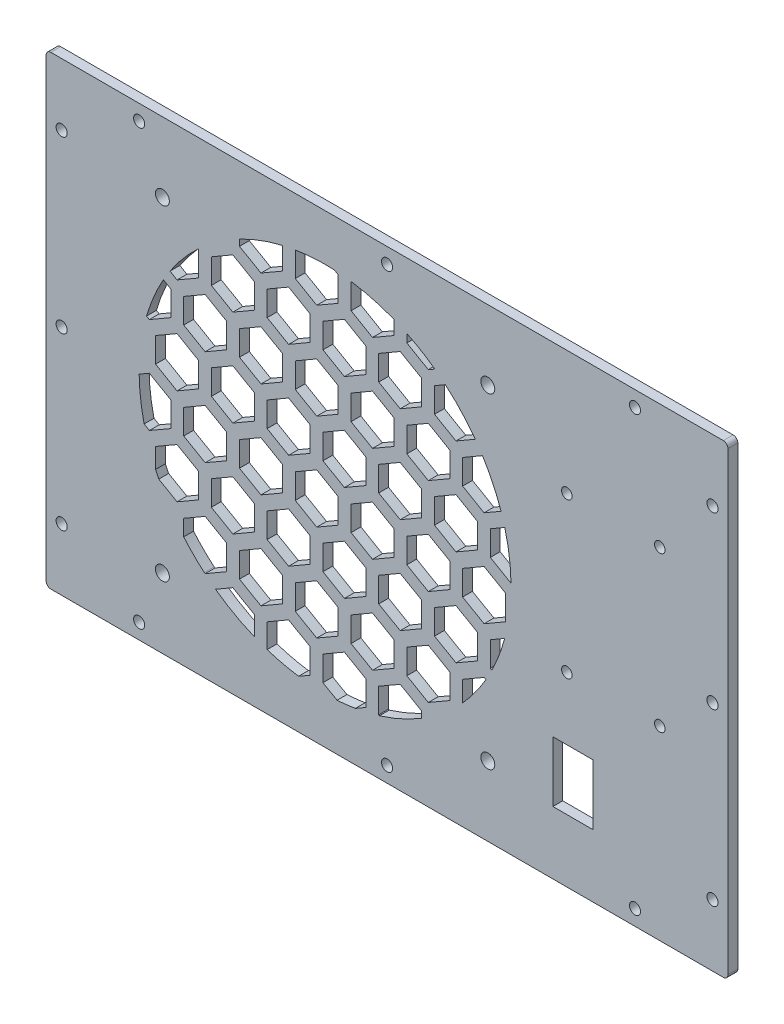
from build123d import *

# Parameters (mm, degrees)
SKETCH1_W            = 220
SKETCH1_H            = 150
BOSS_EXTRUDE1_DEPTH  = 3.175
M3_CLEARANCE_HOLE1_D = 3.6
SKETCH4_W            = 10
SKETCH4_H            = 10
BOSS_EXTRUDE2_DEPTH  = 3.175
FILLET2_R            = 1.5
M4_CLEARANCE_HOLE1_D = 4.5
SKETCH6_R            = 60
CUT_EXTRUDE1_DEPTH   = 10
BOSS_EXTRUDE3_START  = -3.175
BOSS_EXTRUDE3_DEPTH  = 3.175
SKETCH12_W           = 13
SKETCH12_H           = 19.5
CUT_EXTRUDE2_DEPTH   = 134.173122758
M3_CLEARANCE_HOLE2_D = 3.4


# Read off the part's stored shape, not the designer's step: Boss-Extrude3
with BuildPart() as part:
    # Sketch1 → Boss-Extrude1 (new body)
    with BuildSketch(Plane.XY):
        Rectangle(SKETCH1_W, SKETCH1_H)
    extrude(amount=BOSS_EXTRUDE1_DEPTH)

    # M3 Clearance Hole1 (through all)
    with Locations(Plane.XY.offset(3.175)):
        with Locations((0, 0), (-80, 70), (80, 70), (0, 70), (-105, 55), (-105, 0), (-105, -55), (-80, -70), (0, -70), (80, -70), (105, -55), (105, 0), (105, 55)):
            Hole(M3_CLEARANCE_HOLE1_D / 2)

    # Sketch4 → Boss-Extrude2 (add, through all)
    with BuildSketch(Plane.XY.offset(3.175)):
        Rectangle(SKETCH4_W, SKETCH4_H)
    extrude(amount=-BOSS_EXTRUDE2_DEPTH)

    # Fillet2
    fillet2_edges = [part.edges().sort_by_distance(p)[0] for p in [
        (-110, -75, 1.5875),
        (-110, 75, 1.5875),
        (110, 75, 1.5875),
        (110, -75, 1.5875),
    ]]
    fillet(fillet2_edges, radius=FILLET2_R)

    # M4 Clearance Hole1 (through all)
    with Locations(Plane.XY.offset(3.175)):
        with Locations((-72.5, 52.5), (32.5, 52.5), (32.5, -52.5), (-72.5, -52.5)):
            Hole(M4_CLEARANCE_HOLE1_D / 2)

    # Sketch6 → Cut-Extrude1 (cut)
    with BuildSketch(Plane.XY.offset(3.175)):
        with Locations((-20, 0)):
            Circle(SKETCH6_R)
    extrude(amount=-CUT_EXTRUDE1_DEPTH, mode=Mode.SUBTRACT)

    # Boss-Extrude3 outline → Boss-Extrude3 (add)
    with BuildSketch(Plane.XY.offset(3.175).offset(BOSS_EXTRUDE3_START)):
        with BuildLine():
            Line((-15.771267181, 59.221406587), (-15.771267181, 51.221406587))
            Line((-15.771267181, 51.221406587), (-22.699470411, 47.221406587))
            Line((-22.699470411, 47.221406587), (-29.627673641, 51.221406587))
            Line((-29.627673641, 51.221406587), (-29.627673641, 59.221406587))
            Line((-29.627673641, 59.221406587), (-29.624968598, 59.222968344))
            ThreePointArc((-29.624968598, 59.222968344), (-31.705383986, 58.847123853), (-33.771267181, 58.398220865))
            Line((-33.771267181, 58.398220865), (-33.771267181, 51.221406587))
            Line((-33.771267181, 51.221406587), (-40.699470411, 47.221406587))
            Line((-40.699470411, 47.221406587), (-47.627673641, 51.221406587))
            Line((-47.627673641, 51.221406587), (-47.627673641, 53.26078904))
            ThreePointArc((-47.627673641, 53.26078904), (-54.622578831, 49.002826807), (-60.972552501, 43.832065221))
            Line((-60.972552501, 43.832065221), (-60.843063951, 43.757304972))
            Line((-60.843063951, 43.757304972), (-60.843063951, 35.757304972))
            Line((-60.843063951, 35.757304972), (-67.771267181, 31.757304972))
            Line((-67.771267181, 31.757304972), (-70.058522519, 33.077852457))
            ThreePointArc((-70.058522519, 33.077852457), (-71.149938734, 31.363733316), (-72.182683216, 29.613638284))
            Line((-72.182683216, 29.613638284), (-69.771267181, 28.221406587))
            Line((-69.771267181, 28.221406587), (-69.771267181, 20.221406587))
            Line((-69.771267181, 20.221406587), (-76.699470411, 16.221406587))
            Line((-76.699470411, 16.221406587), (-77.614626087, 16.749771963))
            ThreePointArc((-77.614626087, 16.749771963), (-79.4477765, 8.121691275), (-79.996124777, -0.681917699))
            Line((-79.996124777, -0.681917699), (-76.699470411, 1.221406587))
            Line((-76.699470411, 1.221406587), (-69.771267181, -2.778593413))
            Line((-69.771267181, -2.778593413), (-69.771267181, -10.778593413))
            Line((-69.771267181, -10.778593413), (-76.699470411, -14.778593413))
            Line((-76.699470411, -14.778593413), (-78.390962681, -13.802009896))
            ThreePointArc((-78.390962681, -13.802009896), (-76.805098789, -19.317886829), (-74.699470411, -24.657005835))
            Line((-74.699470411, -24.657005835), (-74.699470411, -18.242695028))
            Line((-74.699470411, -18.242695028), (-67.771267181, -14.242695028))
            Line((-67.771267181, -14.242695028), (-60.843063951, -18.242695028))
            Line((-60.843063951, -18.242695028), (-60.843063951, -26.242695028))
            Line((-60.843063951, -26.242695028), (-67.771267181, -30.242695028))
            Line((-67.771267181, -30.242695028), (-73.660873716, -26.84232911))
            ThreePointArc((-73.660873716, -26.84232911), (-70.012814128, -33.146921772), (-65.627673641, -38.963000373))
            Line((-65.627673641, -38.963000373), (-65.627673641, -33.778593413))
            Line((-65.627673641, -33.778593413), (-58.699470411, -29.778593413))
            Line((-58.699470411, -29.778593413), (-51.771267181, -33.778593413))
            Line((-51.771267181, -33.778593413), (-51.771267181, -41.778593413))
            Line((-51.771267181, -41.778593413), (-58.699470411, -45.778593413))
            Line((-58.699470411, -45.778593413), (-58.967443695, -45.623878966))
            ThreePointArc((-58.967443695, -45.623878966), (-57.192526743, -47.082013067), (-55.363097064, -48.471139517))
            Line((-55.363097064, -48.471139517), (-49.771267181, -45.242695028))
            Line((-49.771267181, -45.242695028), (-42.843063951, -49.242695028))
            Line((-42.843063951, -49.242695028), (-42.843063951, -55.481478255))
            ThreePointArc((-42.843063951, -55.481478255), (-40.78535319, -56.284714557), (-38.699470411, -57.011663775))
            Line((-38.699470411, -57.011663775), (-38.699470411, -49.242695028))
            Line((-38.699470411, -49.242695028), (-31.771267181, -45.242695028))
            Line((-31.771267181, -45.242695028), (-24.843063951, -49.242695028))
            Line((-24.843063951, -49.242695028), (-24.843063951, -57.242695028))
            Line((-24.843063951, -57.242695028), (-28.556643636, -59.386731259))
            ThreePointArc((-28.556643636, -59.386731259), (-22.360545451, -59.953547228), (-16.139062936, -59.875647512))
            Line((-16.139062936, -59.875647512), (-20.699470411, -57.242695028))
            Line((-20.699470411, -57.242695028), (-20.699470411, -49.242695028))
            Line((-20.699470411, -49.242695028), (-13.771267181, -45.242695028))
            Line((-13.771267181, -45.242695028), (-6.843063951, -49.242695028))
            Line((-6.843063951, -49.242695028), (-6.843063951, -57.242695028))
            Line((-6.843063951, -57.242695028), (-10.232599569, -59.19964433))
            ThreePointArc((-10.232599569, -59.19964433), (-6.317118817, -58.418993166), (-2.462224364, -57.379669098))
            Line((-2.462224364, -57.379669098), (-2.699470411, -57.242695028))
            Line((-2.699470411, -57.242695028), (-2.699470411, -49.242695028))
            Line((-2.699470411, -49.242695028), (4.228732819, -45.242695028))
            Line((4.228732819, -45.242695028), (11.156936049, -49.242695028))
            Line((11.156936049, -49.242695028), (11.156936049, -51.27616733))
            ThreePointArc((11.156936049, -51.27616733), (18.15510117, -46.305380408), (24.372326359, -40.386837627))
            Line((24.372326359, -40.386837627), (24.372326359, -33.778593413))
            Line((24.372326359, -33.778593413), (31.300529589, -29.778593413))
            Line((31.300529589, -29.778593413), (31.892008488, -30.120083915))
            ThreePointArc((31.892008488, -30.120083915), (32.882355734, -28.345307408), (33.812026068, -26.538007658))
            Line((33.812026068, -26.538007658), (33.300529589, -26.242695028))
            Line((33.300529589, -26.242695028), (33.300529589, -18.242695028))
            Line((33.300529589, -18.242695028), (37.947305409, -15.559877758))
            ThreePointArc((37.947305409, -15.559877758), (39.541377076, -7.404351142), (39.993351207, 0.893202608))
            Line((39.993351207, 0.893202608), (33.300529589, 4.757304972))
            Line((33.300529589, 4.757304972), (33.300529589, 12.757304972))
            Line((33.300529589, 12.757304972), (37.975059683, 15.45614618))
            ThreePointArc((37.975059683, 15.45614618), (37.41210019, 17.431315261), (36.781869404, 19.386059604))
            Line((36.781869404, 19.386059604), (31.300529589, 16.221406587))
            Line((31.300529589, 16.221406587), (24.372326359, 20.221406587))
            Line((24.372326359, 20.221406587), (24.372326359, 28.221406587))
            Line((24.372326359, 28.221406587), (30.797690386, 31.931092237))
            ThreePointArc((30.797690386, 31.931092237), (29.664494055, 33.666571407), (28.472031126, 35.36187493))
            Line((28.472031126, 35.36187493), (22.228732819, 31.757304972))
            Line((22.228732819, 31.757304972), (15.300529589, 35.757304972))
            Line((15.300529589, 35.757304972), (15.300529589, 43.757304972))
            Line((15.300529589, 43.757304972), (18.792026609, 45.773121716))
            ThreePointArc((18.792026609, 45.773121716), (17.124010592, 47.136056661), (15.4081472, 48.438240182))
            Line((15.4081472, 48.438240182), (13.300529589, 47.221406587))
            Line((13.300529589, 47.221406587), (6.372326359, 51.221406587))
            Line((6.372326359, 51.221406587), (6.372326359, 53.89341706))
            ThreePointArc((6.372326359, 53.89341706), (4.317882596, 54.851076435), (2.228732819, 55.73045341))
            Line((2.228732819, 55.73045341), (2.228732819, 51.221406587))
            Line((2.228732819, 51.221406587), (-4.699470411, 47.221406587))
            Line((-4.699470411, 47.221406587), (-11.627673641, 51.221406587))
            Line((-11.627673641, 51.221406587), (-11.627673641, 59.221406587))
            Line((-11.627673641, 59.221406587), (-11.361780135, 59.374920274))
            ThreePointArc((-11.361780135, 59.374920274), (-14.168853948, 59.715975549), (-16.988879355, 59.924395303))
            Line((-16.988879355, 59.924395303), (-15.771267181, 59.221406587))
        make_face()
        Polygon((-33.771267181, -33.778593413), (-33.771267181, -41.778593413), (-40.699470411, -45.778593413), (-47.627673641, -41.778593413), (-47.627673641, -33.778593413), (-40.699470411, -29.778593413), align=None, mode=Mode.SUBTRACT)
        Polygon((-15.771267181, -33.778593413), (-15.771267181, -41.778593413), (-22.699470411, -45.778593413), (-29.627673641, -41.778593413), (-29.627673641, -33.778593413), (-22.699470411, -29.778593413), align=None, mode=Mode.SUBTRACT)
        Polygon((-51.771267181, -2.778593413), (-51.771267181, -10.778593413), (-58.699470411, -14.778593413), (-65.627673641, -10.778593413), (-65.627673641, -2.778593413), (-58.699470411, 1.221406587), align=None, mode=Mode.SUBTRACT)
        Polygon((-42.843063951, -18.242695028), (-42.843063951, -26.242695028), (-49.771267181, -30.242695028), (-56.699470411, -26.242695028), (-56.699470411, -18.242695028), (-49.771267181, -14.242695028), align=None, mode=Mode.SUBTRACT)
        Polygon((-24.843063951, -18.242695028), (-24.843063951, -26.242695028), (-31.771267181, -30.242695028), (-38.699470411, -26.242695028), (-38.699470411, -18.242695028), (-31.771267181, -14.242695028), align=None, mode=Mode.SUBTRACT)
        Polygon((-33.771267181, -2.778593413), (-33.771267181, -10.778593413), (-40.699470411, -14.778593413), (-47.627673641, -10.778593413), (-47.627673641, -2.778593413), (-40.699470411, 1.221406587), align=None, mode=Mode.SUBTRACT)
        Polygon((-15.771267181, -2.778593413), (-15.771267181, -10.778593413), (-22.699470411, -14.778593413), (-29.627673641, -10.778593413), (-29.627673641, -2.778593413), (-22.699470411, 1.221406587), align=None, mode=Mode.SUBTRACT)
        Polygon((2.228732819, -33.778593413), (2.228732819, -41.778593413), (-4.699470411, -45.778593413), (-11.627673641, -41.778593413), (-11.627673641, -33.778593413), (-4.699470411, -29.778593413), align=None, mode=Mode.SUBTRACT)
        Polygon((20.228732819, -33.778593413), (20.228732819, -41.778593413), (13.300529589, -45.778593413), (6.372326359, -41.778593413), (6.372326359, -33.778593413), (13.300529589, -29.778593413), align=None, mode=Mode.SUBTRACT)
        Polygon((-6.843063951, -18.242695028), (-6.843063951, -26.242695028), (-13.771267181, -30.242695028), (-20.699470411, -26.242695028), (-20.699470411, -18.242695028), (-13.771267181, -14.242695028), align=None, mode=Mode.SUBTRACT)
        Polygon((11.156936049, -18.242695028), (11.156936049, -26.242695028), (4.228732819, -30.242695028), (-2.699470411, -26.242695028), (-2.699470411, -18.242695028), (4.228732819, -14.242695028), align=None, mode=Mode.SUBTRACT)
        Polygon((2.228732819, -2.778593413), (2.228732819, -10.778593413), (-4.699470411, -14.778593413), (-11.627673641, -10.778593413), (-11.627673641, -2.778593413), (-4.699470411, 1.221406587), align=None, mode=Mode.SUBTRACT)
        Polygon((29.156936049, -18.242695028), (29.156936049, -26.242695028), (22.228732819, -30.242695028), (15.300529589, -26.242695028), (15.300529589, -18.242695028), (22.228732819, -14.242695028), align=None, mode=Mode.SUBTRACT)
        Polygon((20.228732819, -2.778593413), (20.228732819, -10.778593413), (13.300529589, -14.778593413), (6.372326359, -10.778593413), (6.372326359, -2.778593413), (13.300529589, 1.221406587), align=None, mode=Mode.SUBTRACT)
        Polygon((38.228732819, -2.778593413), (38.228732819, -10.778593413), (31.300529589, -14.778593413), (24.372326359, -10.778593413), (24.372326359, -2.778593413), (31.300529589, 1.221406587), align=None, mode=Mode.SUBTRACT)
        Polygon((-60.843063951, 12.757304972), (-60.843063951, 4.757304972), (-67.771267181, 0.757304972), (-74.699470411, 4.757304972), (-74.699470411, 12.757304972), (-67.771267181, 16.757304972), align=None, mode=Mode.SUBTRACT)
        Polygon((-51.771267181, 28.221406587), (-51.771267181, 20.221406587), (-58.699470411, 16.221406587), (-65.627673641, 20.221406587), (-65.627673641, 28.221406587), (-58.699470411, 32.221406587), align=None, mode=Mode.SUBTRACT)
        Polygon((-42.843063951, 12.757304972), (-42.843063951, 4.757304972), (-49.771267181, 0.757304972), (-56.699470411, 4.757304972), (-56.699470411, 12.757304972), (-49.771267181, 16.757304972), align=None, mode=Mode.SUBTRACT)
        Polygon((-24.843063951, 12.757304972), (-24.843063951, 4.757304972), (-31.771267181, 0.757304972), (-38.699470411, 4.757304972), (-38.699470411, 12.757304972), (-31.771267181, 16.757304972), align=None, mode=Mode.SUBTRACT)
        Polygon((-33.771267181, 28.221406587), (-33.771267181, 20.221406587), (-40.699470411, 16.221406587), (-47.627673641, 20.221406587), (-47.627673641, 28.221406587), (-40.699470411, 32.221406587), align=None, mode=Mode.SUBTRACT)
        Polygon((-15.771267181, 28.221406587), (-15.771267181, 20.221406587), (-22.699470411, 16.221406587), (-29.627673641, 20.221406587), (-29.627673641, 28.221406587), (-22.699470411, 32.221406587), align=None, mode=Mode.SUBTRACT)
        Polygon((-42.843063951, 43.757304972), (-42.843063951, 35.757304972), (-49.771267181, 31.757304972), (-56.699470411, 35.757304972), (-56.699470411, 43.757304972), (-49.771267181, 47.757304972), align=None, mode=Mode.SUBTRACT)
        Polygon((-24.843063951, 43.757304972), (-24.843063951, 35.757304972), (-31.771267181, 31.757304972), (-38.699470411, 35.757304972), (-38.699470411, 43.757304972), (-31.771267181, 47.757304972), align=None, mode=Mode.SUBTRACT)
        Polygon((-6.843063951, 12.757304972), (-6.843063951, 4.757304972), (-13.771267181, 0.757304972), (-20.699470411, 4.757304972), (-20.699470411, 12.757304972), (-13.771267181, 16.757304972), align=None, mode=Mode.SUBTRACT)
        Polygon((11.156936049, 12.757304972), (11.156936049, 4.757304972), (4.228732819, 0.757304972), (-2.699470411, 4.757304972), (-2.699470411, 12.757304972), (4.228732819, 16.757304972), align=None, mode=Mode.SUBTRACT)
        Polygon((2.228732819, 28.221406587), (2.228732819, 20.221406587), (-4.699470411, 16.221406587), (-11.627673641, 20.221406587), (-11.627673641, 28.221406587), (-4.699470411, 32.221406587), align=None, mode=Mode.SUBTRACT)
        Polygon((29.156936049, 12.757304972), (29.156936049, 4.757304972), (22.228732819, 0.757304972), (15.300529589, 4.757304972), (15.300529589, 12.757304972), (22.228732819, 16.757304972), align=None, mode=Mode.SUBTRACT)
        Polygon((20.228732819, 28.221406587), (20.228732819, 20.221406587), (13.300529589, 16.221406587), (6.372326359, 20.221406587), (6.372326359, 28.221406587), (13.300529589, 32.221406587), align=None, mode=Mode.SUBTRACT)
        Polygon((-6.843063951, 43.757304972), (-6.843063951, 35.757304972), (-13.771267181, 31.757304972), (-20.699470411, 35.757304972), (-20.699470411, 43.757304972), (-13.771267181, 47.757304972), align=None, mode=Mode.SUBTRACT)
        Polygon((11.156936049, 43.757304972), (11.156936049, 35.757304972), (4.228732819, 31.757304972), (-2.699470411, 35.757304972), (-2.699470411, 43.757304972), (4.228732819, 47.757304972), align=None, mode=Mode.SUBTRACT)
    extrude(amount=BOSS_EXTRUDE3_DEPTH)

    # Sketch12 → Cut-Extrude2 (cut, through all)
    with BuildSketch(Plane.XY.offset(3.175)):
        with Locations((60, -45)):
            Rectangle(SKETCH12_W, SKETCH12_H)
    extrude(amount=-CUT_EXTRUDE2_DEPTH, mode=Mode.SUBTRACT)

    # M3 Clearance Hole2 (through all)
    with Locations(Plane.XY.offset(3.175)):
        with Locations((58, 35), (88, -15), (58, -15), (88, 35)):
            Hole(M3_CLEARANCE_HOLE2_D / 2)


solid = part.part
